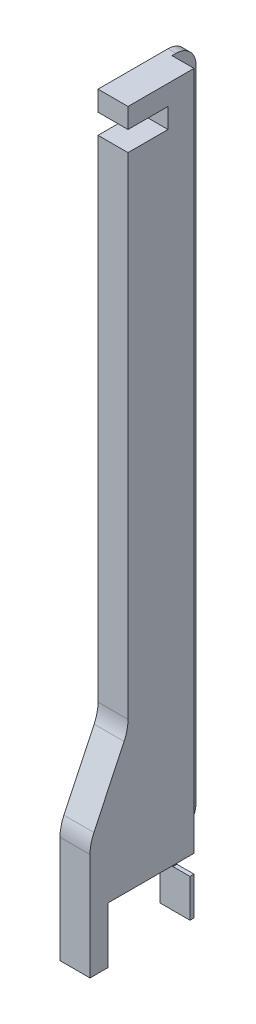
from build123d import *

# Parameters (mm, degrees)
EXTRUDE_1_DEPTH        = 26
EXTRUDE_2_DEPTH        = 19
FILLET_1_R             = 10
SKETCH_5_W             = 161
SKETCH_5_H             = 6
CUT_EXTRUDE_1_DEPTH    = 52
SKETCH_1_5_W           = 11
SKETCH_1_5_H           = 340
EXTRUDE_4_DEPTH        = 7
SKETCH_6_W             = 1.9
SKETCH_6_H             = 2
SKETCH_6_W_2           = 6.6
EXTRUDE_5_DEPTH        = 28
SKETCH_6_3_W           = 6.6
SKETCH_6_3_H           = 2
CUT_EXTRUDE_2_DEPTH    = 5
FILLET_2_R             = 20
SKETCH_6_4_W           = 15
SKETCH_6_4_H           = 10
SKETCH_6_4_H_2         = 9
EXTRUDE_6_DEPTH        = 30
SKETCH_6_5_W           = 15
SKETCH_6_5_H           = 9
EXTRUDE_7_DEPTH        = 28
EXTRUDE_8_DEPTH        = 15
FILLET_3_R             = 20
FILLET_3_OF_MIRROR_2_R = 20
FILLET_4_R             = 20
SKETCH_11_W            = 20
SKETCH_11_H            = 20
CUT_EXTRUDE_3_DEPTH    = 617
SKETCH_10_W            = 20
SKETCH_10_H            = 10
CUT_EXTRUDE_4_DEPTH    = 617
SKETCH_13_W            = 2
SKETCH_13_H            = 9
CUT_EXTRUDE_8_DEPTH    = 8.5


with BuildPart() as part:
    # 스케치1 → 보스-돌출1 (new body)
    with BuildSketch(Plane.XY):
        Polygon((-168, 0), (168, 0), (183, 0), (183, -340), (168, -340), (168, -20), (-168, -20), (-168, -340), (-183, -340), (-183, 0), align=None)
    extrude(amount=EXTRUDE_1_DEPTH)

    # 스케치1<4> → 보스-돌출2 (add)
    with BuildSketch(Plane.XY):
        Polygon((172, 0), (168, 0), (168, -20), (168, -340), (172, -340), align=None)
        Polygon((-168, -20), (-168, 0), (-172, 0), (-172, -340), (-168, -340), align=None)
    extrude(amount=-EXTRUDE_2_DEPTH)

    # 필렛1
    fillet_1_edges = [part.edges().sort_by_distance(p)[0] for p in [
        (170, 0, -19),
        (170, -340, -19),
        (-170, -340, -19),
        (-170, 0, -19),
    ]]
    fillet(fillet_1_edges, radius=FILLET_1_R)

    # 스케치5 → 컷-돌출1 (cut)
    with BuildSketch(Plane(origin=(0, 0, 0), x_dir=(1, 0, 0), z_dir=(0, 1, 0))):
        with Locations((-87.5, -3)):
            Rectangle(SKETCH_5_W, SKETCH_5_H)
        with Locations((87.5, -3)):
            Rectangle(SKETCH_5_W, SKETCH_5_H)
    extrude(amount=-CUT_EXTRUDE_1_DEPTH, mode=Mode.SUBTRACT)

    # 스케치1<5> → 보스-돌출4 (add)
    with BuildSketch(Plane.XY):
        with Locations((177.5, -170)):
            Rectangle(SKETCH_1_5_W, SKETCH_1_5_H)
        with Locations((-177.5, -170)):
            Rectangle(SKETCH_1_5_W, SKETCH_1_5_H)
    extrude(amount=-EXTRUDE_4_DEPTH)

    # 스케치6 → 보스-돌출5 (add)
    with BuildSketch(Plane.XZ.offset(340)):
        with Locations((-182.05, -6)):
            Rectangle(SKETCH_6_W, SKETCH_6_H)
        with Locations((-177.8, -6)):
            Rectangle(SKETCH_6_W_2, SKETCH_6_H)
        Polygon((-174.5, -7), (-172, -7), (-168, -7), (-168, -5), (-174.5, -5), align=None)
    extrude_5 = extrude(amount=EXTRUDE_5_DEPTH)

    # 스케치6<3> → 컷-돌출2 (cut)
    with BuildSketch(Plane.XZ.offset(340)):
        with Locations((-177.8, -6)):
            Rectangle(SKETCH_6_3_W, SKETCH_6_3_H)
    cut_extrude_2 = extrude(amount=CUT_EXTRUDE_2_DEPTH, mode=Mode.SUBTRACT)

    # 필렛2
    # the kernel refuses this fillet: 20 mm, written as the material it adds along each edge
    with BuildSketch(Plane(origin=(-172, -340, -7), x_dir=(0, -1, 0), z_dir=(1, 0, 0))) as fillet_2_piece_1:
        with BuildLine():
            CenterArc((14, 20), FILLET_2_R, 216.869897646, 53.130102354)
            Line((-2, 8), (-3.6, 6.8))
            ThreePointArc((-3.6, 6.8), (-2, 2), (-2, 0))
            Line((-2, 0), (0, -2))
            Line((0, -2), (14, -2))
            Line((14, -2), (14, 0))
        make_face()
    extrude(amount=4)

    # 스케치6<4> → 보스-돌출6 (add)
    with BuildSketch(Plane.XZ.offset(340)):
        with Locations((-175.5, 31)):
            Rectangle(SKETCH_6_4_W, SKETCH_6_4_H)
        with Locations((-175.5, 40.5)):
            Rectangle(SKETCH_6_4_W, SKETCH_6_4_H_2)
    extrude_6 = extrude(amount=-EXTRUDE_6_DEPTH)

    # 스케치6<5> → 보스-돌출7 (add)
    with BuildSketch(Plane.XZ.offset(340)):
        with Locations((-175.5, 40.5)):
            Rectangle(SKETCH_6_5_W, SKETCH_6_5_H)
    extrude_7 = extrude(amount=EXTRUDE_7_DEPTH)

    # 스케치9 → 보스-돌출8 (add)
    with BuildSketch(Plane.ZY.offset(183)):
        Polygon((26, -310), (45, -310), (26, -270), align=None)
    extrude_8 = extrude(amount=-EXTRUDE_8_DEPTH)

    # 필렛3
    fillet_3_edges = [part.edges().sort_by_distance(p)[0] for p in [
        (-175.5, -310, 45),
        (-175.5, -270, 26),
    ]]
    fillet(fillet_3_edges, radius=FILLET_3_R)

    # 대칭 복사2: 보스-돌출5, 컷-돌출2, 보스-돌출6, 보스-돌출7, 보스-돌출8 across plane
    add(extrude_5.mirror(Plane(origin=(0, 0, 0), x_dir=(0, 0, 1), z_dir=(1, 0, 0))))
    add(cut_extrude_2.mirror(Plane(origin=(0, 0, 0), x_dir=(0, 0, 1), z_dir=(1, 0, 0))), mode=Mode.SUBTRACT)
    add(extrude_6.mirror(Plane(origin=(0, 0, 0), x_dir=(0, 0, 1), z_dir=(1, 0, 0))))
    add(extrude_7.mirror(Plane(origin=(0, 0, 0), x_dir=(0, 0, 1), z_dir=(1, 0, 0))))
    add(extrude_8.mirror(Plane(origin=(0, 0, 0), x_dir=(0, 0, 1), z_dir=(1, 0, 0))))

    # 필렛3 of 대칭 복사2
    fillet_3_of_mirror_2_edges = [part.edges().sort_by_distance(p)[0] for p in [
        (175.5, -310, 45),
        (175.5, -270, 26),
    ]]
    fillet(fillet_3_of_mirror_2_edges, radius=FILLET_3_OF_MIRROR_2_R)

    # 필렛4
    # the kernel refuses this fillet: 20 mm, written as the material it adds along each edge
    with BuildSketch(Plane(origin=(172, -340, -7), x_dir=(0, 0.24253562503633938, -0.9701425001453302), z_dir=(-1, 0, 0))) as fillet_4_piece_1:
        with BuildLine():
            CenterArc((16.007351252, 18.432707503), FILLET_4_R, 194.036243468, 53.130102354)
            Line((-3.395498751, 13.581995002), (-5.335783751, 13.096923752))
            Line((-5.335783751, 13.096923752), (-1.940285, -0.48507125))
            Line((-1.940285, -0.48507125), (0.48507125, -1.940285))
            ThreePointArc((0.48507125, -1.940285), (2.42535625, -1.45521375), (7.470097251, -1.84327075))
            Line((7.470097251, -1.84327075), (8.246211251, 0))
        make_face()
    extrude(amount=4)

    # 스케치11 → 컷-돌출3 (cut)
    with BuildSketch(Plane.ZY.offset(-168)):
        with BuildLine():
            ThreePointArc((45, -314.508610159), (44.510394688, -310.110371974), (43.065550087, -305.927473868))
            Line((43.065550087, -305.927473868), (27.934449913, -274.072526132))
            ThreePointArc((27.934449913, -274.072526132), (26.489605312, -269.889628026), (26, -265.491389841))
            Line((26, -265.491389841), (26, -20))
            Line((26, -20), (6, -20))
            Line((6, -20), (6, 0))
            Line((6, 0), (-7, 0))
            Line((-7, 0), (-7, -354))
            Line((-7, -354), (-7, -368))
            Line((-7, -368), (-5, -368))
            Line((-5, -368), (-5, -340))
            Line((-5, -340), (36, -340))
            Line((36, -340), (36, -368))
            Line((36, -368), (45, -368))
            Line((45, -368), (45, -314.508610159))
        make_face()
        with Locations((16, -10)):
            Rectangle(SKETCH_11_W, SKETCH_11_H)
        with BuildLine():
            Line((-7, -354), (-7, 0))
            Line((-7, 0), (-9, 0))
            ThreePointArc((-9, 0), (-16.071067812, -2.928932188), (-19, -10))
            Line((-19, -10), (-19, -330))
            ThreePointArc((-19, -330), (-17.94427191, -334.472135955), (-15, -338))
            ThreePointArc((-15, -338), (-9.11145618, -345.05572809), (-7, -354))
        make_face()
    extrude(amount=CUT_EXTRUDE_3_DEPTH, mode=Mode.SUBTRACT)

    # 스케치10 → 컷-돌출4 (cut)
    with BuildSketch(Plane(origin=(183, 0, 0), x_dir=(0, 0, -1), z_dir=(1, 0, 0))):
        with Locations((-16, -15)):
            Rectangle(SKETCH_10_W, SKETCH_10_H)
    extrude(amount=-CUT_EXTRUDE_4_DEPTH, mode=Mode.SUBTRACT)

    # 스케치13 → 컷-돌출8 (cut)
    with BuildSketch(Plane(origin=(183, 0, 0), x_dir=(0, 0, -1), z_dir=(1, 0, 0))):
        with Locations((6, -344.5)):
            Rectangle(SKETCH_13_W, SKETCH_13_H)
    extrude(amount=-CUT_EXTRUDE_8_DEPTH, mode=Mode.SUBTRACT)


solid = part.part
